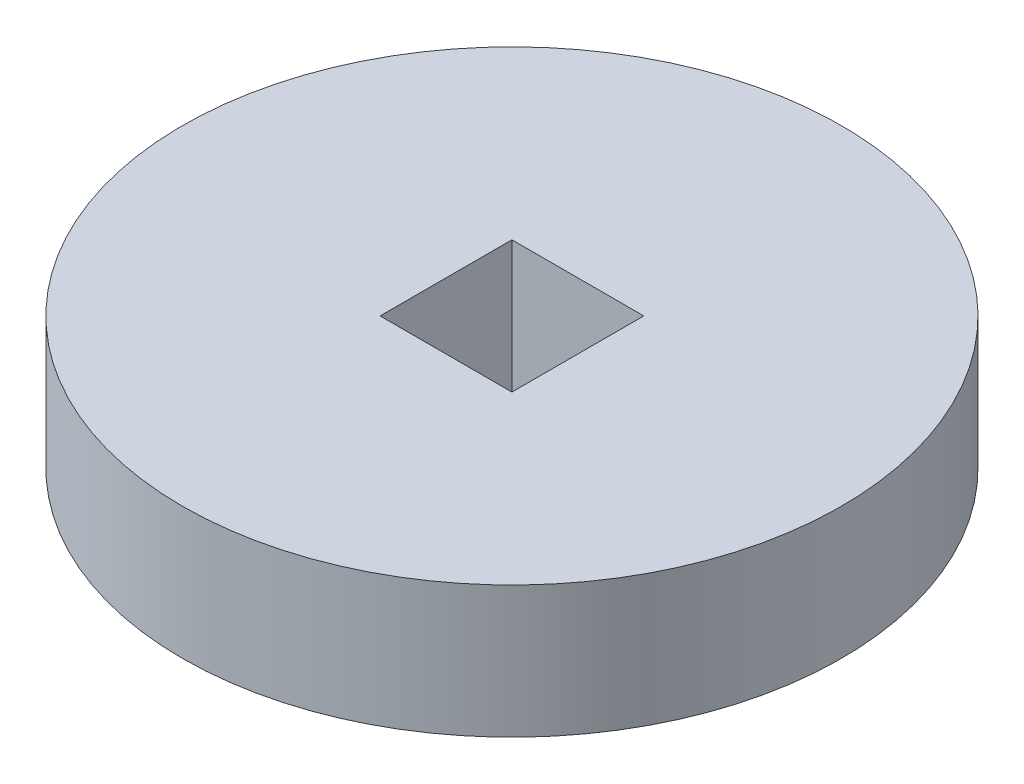
from build123d import *

# Parameters (mm, degrees)
ELEVATOR_SUPPORT_PULLEYS_R = 15.875
ELEVATOR_SUPPORT_PULLEYS_W = 6.35
ELEVATOR_SUPPORT_PULLEYS_H = 6.35
BOSS_EXTRUDE1_DEPTH        = 6.35


with BuildPart() as part:
    # Elevator Support Pulleys → Boss-Extrude1 (new body)
    with BuildSketch(Plane(origin=(0, 0, 0), x_dir=(1, 0, 0), z_dir=(0, 1, 0))):
        Circle(ELEVATOR_SUPPORT_PULLEYS_R)
        Rectangle(ELEVATOR_SUPPORT_PULLEYS_W, ELEVATOR_SUPPORT_PULLEYS_H, mode=Mode.SUBTRACT)
    extrude(amount=BOSS_EXTRUDE1_DEPTH)


solid = part.part
